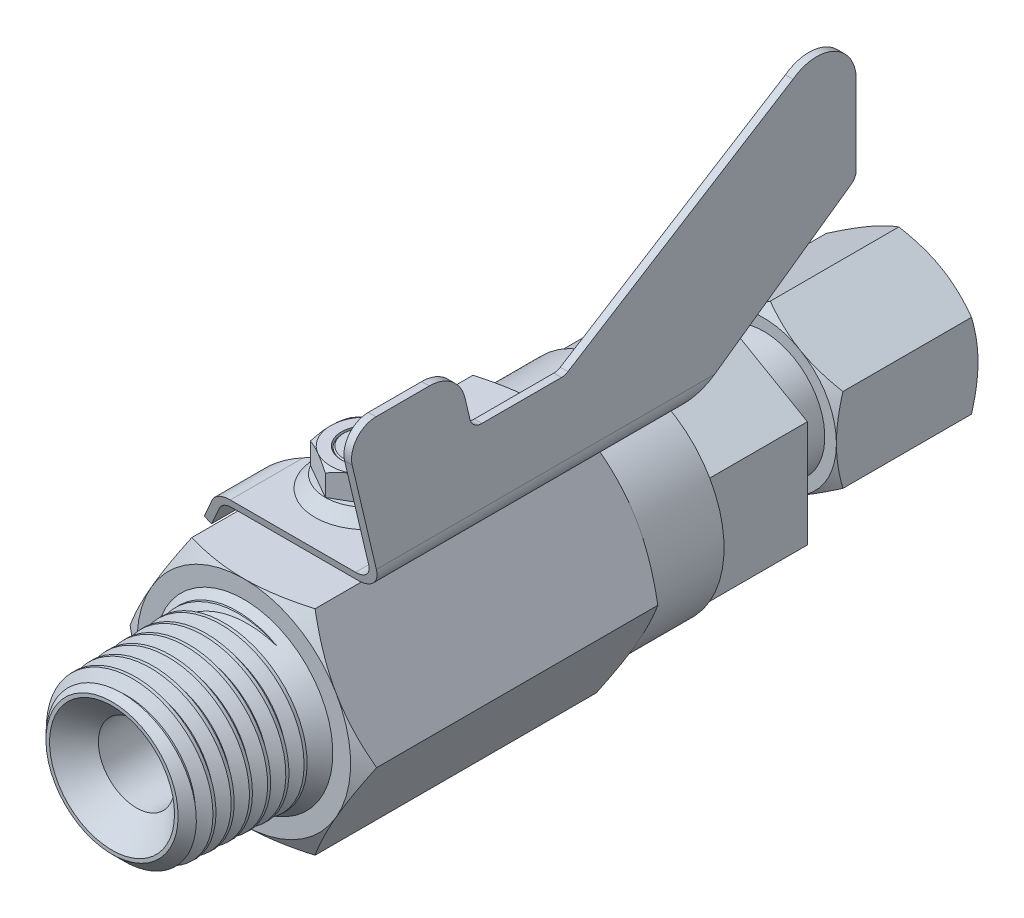
from build123d import *

# Parameters (mm, degrees)
SKETCH1_W              = 31.242
SKETCH1_H              = 12.827
SKETCH2_OUTSIDE_W      = 37.23
SKETCH2_OUTSIDE_H      = 37.23
CUT_EXTRUDE1_DEPTH     = 37.126533
SKETCH5_R              = 4.7498
BOSS_EXTRUDE1_DEPTH    = 1.016
BOSS_EXTRUDE2_DEPTH    = 52.5272
CUT_EXTRUDE2_START     = -19.204414
CUT_EXTRUDE2_DEPTH     = 19.204414
CUT_EXTRUDE3_DEPTH     = 61.997318
SKETCH11_R             = 5.28955
BOSS_EXTRUDE3_DEPTH    = 1.27
BOSS_EXTRUDE3_TAPER    = 40
BOSS_EXTRUDE4_DEPTH    = 2.54
CUT_EXTRUDE4_START     = -7.888877
SKETCH13_R             = 2.54
CUT_EXTRUDE4_DEPTH     = 29.133619
SKETCH14_R             = 2.413
BOSS_EXTRUDE5_DEPTH    = 3.81
CHAMFER1_SIZE          = 0.127
SKETCH15_OUTSIDE_W     = 51.938
SKETCH15_OUTSIDE_H     = 80.399
SKETCH15_OUTSIDE_R     = 3.657999
CUT_EXTRUDE7_DEPTH     = 2.54
CUT_EXTRUDE7_DRAFT     = -60
FILLET1_R              = 2.54
SKETCH16_OUTSIDE_W     = 51.938
SKETCH16_OUTSIDE_H     = 75.366
SKETCH16_OUTSIDE_R     = 11.108508
CUT_EXTRUDE8_DEPTH     = 2.54
CUT_EXTRUDE8_DRAFT     = -60
SKETCH17_OUTSIDE_W     = 51.938
SKETCH17_OUTSIDE_H     = 75.366
SKETCH17_OUTSIDE_R     = 11.108508
CUT_EXTRUDE9_DEPTH     = 2.54
CUT_EXTRUDE9_DRAFT     = -60
CHAMFER2_SIZE          = 1.27
CHAMFER2_SIZE2         = 1.311366
CUT_SWEEP1_PITCH       = 1.840888
CUT_SWEEP1_HEIGHT      = 15.556
CUT_SWEEP1_RADIUS      = 8.14625
CUT_SWEEP1_START_ANGLE = 90
BOSS_EXTRUDE10_DEPTH   = 7.62
BOSS_EXTRUDE11_DEPTH   = 10.16
SKETCH34_R             = 6.35
BOSS_EXTRUDE14_DEPTH   = 5.08
BOSS_EXTRUDE15_DEPTH   = 14.732
SKETCH38_OUTSIDE_W     = 65.132
SKETCH38_OUTSIDE_H     = 88.56
SKETCH38_OUTSIDE_R     = 7.559756
CUT_EXTRUDE10_DEPTH    = 5.08
CUT_EXTRUDE10_DRAFT    = -60
SKETCH39_OUTSIDE_W     = 65.132
SKETCH39_OUTSIDE_H     = 88.56
SKETCH39_OUTSIDE_R     = 7.559756
CUT_EXTRUDE11_DEPTH    = 5.08
CUT_EXTRUDE11_DRAFT    = -60
SKETCH40_R             = 3.9624
CUT_EXTRUDE12_DEPTH    = 82.55
SKETCH41_R             = 4.7625
CUT_EXTRUDE13_DEPTH    = 14.732
CHAMFER4_SIZE          = 2.54


with BuildPart() as part:
    # Sketch1 → Revolve1 (revolve)
    with BuildSketch(Plane(origin=(0, 0, 0), x_dir=(0, 0, -1), z_dir=(1, 0, 0))):
        with Locations((15.621, 6.4135)):
            Rectangle(SKETCH1_W, SKETCH1_H)
    revolve(axis=Axis((0, 0, -31.242), (0, 0, 1)))

    # Sketch2 outside → Cut-Extrude1 (cut, through all)
    with BuildSketch(Plane.XY):
        Rectangle(SKETCH2_OUTSIDE_W, SKETCH2_OUTSIDE_H)
        Polygon((-12.827, 0), (-6.4135, -11.108508), (6.4135, -11.108508), (12.827, 0), (6.4135, 11.108508), (-6.4135, 11.108508), align=None, mode=Mode.SUBTRACT)
    extrude(amount=-CUT_EXTRUDE1_DEPTH, mode=Mode.SUBTRACT)

    # Sketch5 → Boss-Extrude1 (add)
    with BuildSketch(Plane(origin=(0, 11.108508, 0), x_dir=(1, 0, 0), z_dir=(0, 1, 0))):
        with Locations(Location((0, 12.7, 0), (0, 0, 180))):
            Circle(SKETCH5_R)
    extrude(amount=BOSS_EXTRUDE1_DEPTH)


with BuildPart() as body_2:
    # Sketch6 → Boss-Extrude2 (new body)
    with BuildSketch(Plane.XY.offset(-1.5875)):
        with BuildLine():
            Line((-5.973559, 12.124508), (7.08025, 12.124508))
            ThreePointArc((7.08025, 12.124508), (8.876301, 12.868457), (9.62025, 14.664508))
            Line((9.62025, 14.664508), (9.62025, 37.973))
            Line((9.62025, 37.973), (8.8265, 37.973))
            Line((8.8265, 37.973), (8.8265, 14.696258))
            ThreePointArc((8.8265, 14.696258), (8.305736, 13.439022), (7.0485, 12.918258))
            Line((7.0485, 12.918258), (-5.99189, 12.918258))
            ThreePointArc((-5.99189, 12.918258), (-7.26189, 12.577962), (-8.191594, 11.648258))
            Line((-8.191594, 11.648258), (-9.584164, 9.236256))
            Line((-9.584164, 9.236256), (-8.896757, 8.839381))
            Line((-8.896757, 8.839381), (-7.513352, 11.235508))
            ThreePointArc((-7.513352, 11.235508), (-6.862559, 11.886301), (-5.973559, 12.124508))
        make_face()
    extrude(amount=-BOSS_EXTRUDE2_DEPTH)

    # Sketch8 → Cut-Extrude2 (cut)
    with BuildSketch(Plane(origin=(9.62025, 0, 0), x_dir=(0, 0, -1), z_dir=(1, 0, 0)).offset(CUT_EXTRUDE2_START)):
        with BuildLine():
            Line((1.655336, 25.324902), (5.543697, 8.839381))
            Line((5.543697, 8.839381), (1.5875, 8.839381))
            Line((1.5875, 8.839381), (-4.7625, 8.839381))
            Line((-4.7625, 8.839381), (-4.7625, 44.323))
            Line((-4.7625, 44.323), (60.4647, 44.323))
            Line((60.4647, 44.323), (60.4647, 8.839381))
            Line((60.4647, 8.839381), (35.78225, 8.839381))
            Line((35.78225, 8.839381), (35.78225, 12.124508))
            Line((35.78225, 12.124508), (53.576471, 24.669307))
            ThreePointArc((53.576471, 24.669307), (53.972142, 25.122675), (54.1147, 25.707291))
            Line((54.1147, 25.707291), (54.1147, 33.839636))
            ThreePointArc((54.1147, 33.839636), (51.844334, 37.529343), (47.52736, 37.1657))
            Line((47.52736, 37.1657), (24.102603, 22.528287))
            ThreePointArc((24.102603, 22.528287), (23.779665, 22.384506), (23.429605, 22.335308))
            Line((23.429605, 22.335308), (15.147071, 22.335308))
            ThreePointArc((15.147071, 22.335308), (14.358835, 22.609525), (13.910989, 23.313759))
            Line((13.910989, 23.313759), (13.392348, 25.512647))
            ThreePointArc((13.392348, 25.512647), (12.04881, 27.625349), (9.684101, 28.448))
            Line((9.684101, 28.448), (4.1275, 28.448))
            ThreePointArc((4.1275, 28.448), (2.135934, 27.484473), (1.655336, 25.324902))
        make_face()
    extrude(amount=CUT_EXTRUDE2_DEPTH, mode=Mode.SUBTRACT)

    # Sketch10 → Cut-Extrude3 (cut, through all)
    with BuildSketch(Plane(origin=(0, 12.918258, 0), x_dir=(1, 0, 0), z_dir=(0, 1, 0))):
        with BuildLine():
            Line((-9.584164, 7.990088), (-5.781127, 12.423071))
            ThreePointArc((-5.781127, 12.423071), (-5.607243, 12.708663), (-5.533432, 13.034777))
            ThreePointArc((-5.533432, 13.034777), (-4.106476, 16.42395), (-0.872525, 18.174454))
            ThreePointArc((-0.872525, 18.174454), (-0.247775, 18.52493), (0, 19.197056))
            Line((0, 19.197056), (0, 36.908148))
            Line((0, 36.908148), (-9.584164, 36.908148))
            Line((-9.584164, 36.908148), (-9.584164, 7.990088))
        make_face()
    extrude(amount=-CUT_EXTRUDE3_DEPTH, mode=Mode.SUBTRACT)

    # Fillet1
    # the kernel refuses this fillet: 2.54 mm, written as the material it takes off along each edge
    with BuildSketch(Plane(origin=(0, 8.465651, -30.59233), x_dir=(1, 0, 0), z_dir=(0, 0.5761978666695496, -0.817310233904764))) as fillet1_piece_1:
        with BuildLine():
            CenterArc((FILLET1_R, -FILLET1_R), FILLET1_R, 90, 90)
            Line((0, -FILLET1_R), (0, 0))
            Line((0, 0), (FILLET1_R, 0))
        make_face()
    extrude(amount=14.077565, mode=Mode.SUBTRACT)



with BuildPart() as body_3:
    # Sketch11 → Boss-Extrude3 (new body)
    with BuildSketch(Plane(origin=(0, 12.918258, 0), x_dir=(1, 0, 0), z_dir=(0, 1, 0))):
        with Locations((0, 12.7)):
            Circle(SKETCH11_R)
    extrude(amount=BOSS_EXTRUDE3_DEPTH, taper=BOSS_EXTRUDE3_TAPER)


with BuildPart() as body_4:
    # Sketch12 → Boss-Extrude4 (new body)
    with BuildSketch(Plane(origin=(0, 14.188258, 0), x_dir=(1, 0, 0), z_dir=(0, 1, 0))):
        Polygon((0, 16.923893), (-3.657999, 14.811947), (-3.657999, 10.588053), (0, 8.476107), (3.657999, 10.588053), (3.657999, 14.811947), align=None)
    extrude(amount=BOSS_EXTRUDE4_DEPTH)


with BuildPart() as cut_extrude4_tool:
    # Sketch13 → Cut-Extrude4 (new body)
    with BuildSketch(Plane(origin=(0, 16.728258, 0), x_dir=(1, 0, 0), z_dir=(0, 1, 0)).offset(CUT_EXTRUDE4_START)):
        with Locations(Location((0, 12.7, 0), (0, 0, 270))):
            Circle(SKETCH13_R)
    extrude(amount=CUT_EXTRUDE4_DEPTH)


with BuildPart() as body_3_1:
    add(body_3.part)

    # Cut-Extrude4: cut by cut_extrude4_tool
    add(cut_extrude4_tool.part, mode=Mode.SUBTRACT)


with BuildPart() as body_4_1:
    add(body_4.part)

    # Cut-Extrude4: cut by cut_extrude4_tool
    add(cut_extrude4_tool.part, mode=Mode.SUBTRACT)


with BuildPart() as body_5:
    # Sketch14 → Boss-Extrude5 (new body)
    with BuildSketch(Plane(origin=(0, 12.918258, 0), x_dir=(1, 0, 0), z_dir=(0, 1, 0))):
        with Locations(Location((0, 12.7, 0), (0, 0, 270))):
            Circle(SKETCH14_R)
    extrude(amount=BOSS_EXTRUDE5_DEPTH)

    # Chamfer1
    chamfer1_edges = [body_5.edges().sort_by_distance(p)[0] for p in [
        (0, 16.728258, -15.113),
    ]]
    chamfer(chamfer1_edges, length=CHAMFER1_SIZE)


with BuildPart() as cut_extrude7_tool:
    # Sketch15 outside → Cut-Extrude7 (with draft: the straight prism first)
    with BuildSketch(Plane(origin=(0, 16.728258, 0), x_dir=(1, 0, 0), z_dir=(0, 1, 0))):
        with Locations((0, 27.0575)):
            Rectangle(SKETCH15_OUTSIDE_W, SKETCH15_OUTSIDE_H)
        with Locations((0, 12.7)):
            Circle(SKETCH15_OUTSIDE_R, mode=Mode.SUBTRACT)
    extrude(amount=-CUT_EXTRUDE7_DEPTH)
    # Cut-Extrude7: the draft: its side faces are tilted about the plane it starts from
    cut_extrude7_sides = [cut_extrude7_tool.faces().sort_by_distance(p)[0] for p in [
        (0, 15.458258, 13.142),
        (25.969, 15.458258, -27.0575),
        (0, 15.458258, -67.257),
        (-25.969, 15.458258, -27.0575),
        (-3.657999, 15.458258, -12.7),
    ]]
    draft(cut_extrude7_sides, Plane(origin=(0, 16.728258, 0), x_dir=(1, 0, 0), z_dir=(0, 1, 0)), CUT_EXTRUDE7_DRAFT)


with BuildPart() as body_4_2:
    add(body_4_1.part)

    # Cut-Extrude7: cut by cut_extrude7_tool
    add(cut_extrude7_tool.part, mode=Mode.SUBTRACT)


with BuildPart() as cut_extrude8_tool:
    # Sketch16 outside → Cut-Extrude8 (with draft: the straight prism first)
    with BuildSketch(Plane.XY):
        with Locations((0, 13.432)):
            Rectangle(SKETCH16_OUTSIDE_W, SKETCH16_OUTSIDE_H)
        Circle(SKETCH16_OUTSIDE_R, mode=Mode.SUBTRACT)
    extrude(amount=-CUT_EXTRUDE8_DEPTH)
    # Cut-Extrude8: the draft: its side faces are tilted about the plane it starts from
    cut_extrude8_sides = [cut_extrude8_tool.faces().sort_by_distance(p)[0] for p in [
        (0, -24.251, -1.27),
        (25.969, 13.432, -1.27),
        (0, 51.115, -1.27),
        (-25.969, 13.432, -1.27),
        (-11.108508, 0, -1.27),
    ]]
    draft(cut_extrude8_sides, Plane.XY, CUT_EXTRUDE8_DRAFT)


with BuildPart() as part_1:
    add(part.part)

    # Cut-Extrude8: cut by cut_extrude8_tool
    add(cut_extrude8_tool.part, mode=Mode.SUBTRACT)


with BuildPart() as cut_extrude9_tool:
    # Sketch17 outside → Cut-Extrude9 (with draft: the straight prism first)
    with BuildSketch(Plane(origin=(0, 0, -31.242), x_dir=(-1, 0, 0), z_dir=(0, 0, -1))):
        with Locations((0, 13.432)):
            Rectangle(SKETCH17_OUTSIDE_W, SKETCH17_OUTSIDE_H)
        Circle(SKETCH17_OUTSIDE_R, mode=Mode.SUBTRACT)
    extrude(amount=-CUT_EXTRUDE9_DEPTH)
    # Cut-Extrude9: the draft: its side faces are tilted about the plane it starts from
    cut_extrude9_sides = [cut_extrude9_tool.faces().sort_by_distance(p)[0] for p in [
        (0, -24.251, -29.972),
        (-25.969, 13.432, -29.972),
        (0, 51.115, -29.972),
        (25.969, 13.432, -29.972),
        (11.108508, 0, -29.972),
    ]]
    draft(cut_extrude9_sides, Plane(origin=(0, 0, -31.242), x_dir=(-1, 0, 0), z_dir=(0, 0, -1)), CUT_EXTRUDE9_DRAFT)


with BuildPart() as part_2:
    add(part_1.part)

    # Cut-Extrude9: cut by cut_extrude9_tool
    add(cut_extrude9_tool.part, mode=Mode.SUBTRACT)



with BuildPart() as body_6:
    # Sketch19 → Revolve2 (revolve)
    with BuildSketch(Plane(origin=(0, 0, 0), x_dir=(0, 0, -1), z_dir=(1, 0, 0)), mode=Mode.PRIVATE) as revolve2_sk:
        Polygon((0, 0), (-13.716, 0), (-13.716, 8.14625), (0, 8.5725), align=None)
    revolve(revolve2_sk.sketch.rotate(Axis((0, 0, 0), (0, 0, 1)), 90), axis=Axis((0, 0, 0), (0, 0, 1)))

    # Chamfer2
    chamfer2_edges = [body_6.edges().sort_by_distance(p)[0] for p in [
        (8.14625, 0, 13.716),
    ]]
    chamfer2_side = [body_6.faces().sort_by_distance(p)[0] for p in [
        (0, 0, 13.716),
    ]]
    chamfer(chamfer2_edges, length=CHAMFER2_SIZE, length2=CHAMFER2_SIZE2, reference=chamfer2_side[0])

    # Cut-Sweep1: sweep along a helix
    with BuildLine() as cut_sweep1_path:
        # a taper helix: rise per turn along the axis 1.84, along the cone's slant (build123d's pitch) 1.840888
        add(Helix(CUT_SWEEP1_PITCH, CUT_SWEEP1_HEIGHT, CUT_SWEEP1_RADIUS, center=(0, 0, 13.716), direction=(0, 0, -1), cone_angle=1.78, mode=Mode.PRIVATE).rotate(Axis((0, 0, 13.716), (0, 0, -1)), CUT_SWEEP1_START_ANGLE))
    # Sketch22 → Cut-Sweep1 (sweep, cut)
    with BuildSketch(Plane(origin=(0, 0, 0), x_dir=(0, 0, -1), z_dir=(1, 0, 0))):
        Polygon((-15.326, 8.186983), (-14.636, 6.991868), (-14.406, 6.991868), (-13.716, 8.186983), (-13.63035, 8.335333), align=None)
    sweep(path=cut_sweep1_path.line, is_frenet=True, mode=Mode.SUBTRACT)


with BuildPart() as part_3:
    add(part_2.part)

    add(body_6.part)  # Boss-Extrude6 merges body 6
    # Boss-Extrude6 cone 1 section (through the dimple's axis) → Boss-Extrude6 (revolve)
    with BuildSketch(Plane.YZ):
        Polygon((0, 0), (9.2583, 0), (0, 9.2583), align=None)
    revolve(axis=Axis((0, 0, 0), (0, 0, 1)))


with BuildPart() as body_2_1:
    add(body_2.part)

    add(part_3.part)  # Boss-Extrude10 merges part
    # Sketch32 → Boss-Extrude10 (add)
    with BuildSketch(Plane(origin=(0, 0, -31.242), x_dir=(-1, 0, 0), z_dir=(0, 0, -1))):
        with BuildLine():
            ThreePointArc((9.62025, 5.554254), (5.554254, 9.62025), (0, 11.108508))
            ThreePointArc((0, 11.108508), (-5.554254, 9.62025), (-9.62025, 5.554254))
            ThreePointArc((-9.62025, 5.554254), (-11.108508, 0), (-9.62025, -5.554254))
            ThreePointArc((-9.62025, -5.554254), (-5.554254, -9.62025), (0, -11.108508))
            ThreePointArc((0, -11.108508), (5.554254, -9.62025), (9.62025, -5.554254))
            ThreePointArc((9.62025, -5.554254), (11.108508, 0), (9.62025, 5.554254))
        make_face()
    extrude(amount=BOSS_EXTRUDE10_DEPTH)

    # Sketch33 → Boss-Extrude11 (add)
    with BuildSketch(Plane(origin=(0, 0, -38.862), x_dir=(-1, 0, 0), z_dir=(0, 0, -1))):
        Polygon((0, 11.108508), (-9.62025, 5.554254), (-9.62025, -5.554254), (0, -11.108508), (9.62025, -5.554254), (9.62025, 5.554254), align=None)
    extrude(amount=BOSS_EXTRUDE11_DEPTH)

    # Sketch34 → Boss-Extrude14 (add)
    with BuildSketch(Plane(origin=(0, 0, -49.022), x_dir=(-1, 0, 0), z_dir=(0, 0, -1))):
        Circle(SKETCH34_R)
    extrude(amount=BOSS_EXTRUDE14_DEPTH)

    # Sketch37 → Boss-Extrude15 (add)
    with BuildSketch(Plane(origin=(0, 0, -54.102), x_dir=(-1, 0, 0), z_dir=(0, 0, -1))):
        Polygon((0, 8.729254), (-7.559756, 4.364627), (-7.559756, -4.364627), (0, -8.729254), (7.559756, -4.364627), (7.559756, 4.364627), align=None)
    extrude(amount=BOSS_EXTRUDE15_DEPTH)


with BuildPart() as cut_extrude10_tool:
    # Sketch38 outside → Cut-Extrude10 (with draft: the straight prism first)
    with BuildSketch(Plane.XY.offset(-54.102)):
        with Locations((0, 13.432)):
            Rectangle(SKETCH38_OUTSIDE_W, SKETCH38_OUTSIDE_H)
        Circle(SKETCH38_OUTSIDE_R, mode=Mode.SUBTRACT)
    extrude(amount=-CUT_EXTRUDE10_DEPTH)
    # Cut-Extrude10: the draft: its side faces are tilted about the plane it starts from
    cut_extrude10_sides = [cut_extrude10_tool.faces().sort_by_distance(p)[0] for p in [
        (0, -30.848, -56.642),
        (32.566, 13.432, -56.642),
        (0, 57.712, -56.642),
        (-32.566, 13.432, -56.642),
        (-7.559756, 0, -56.642),
    ]]
    draft(cut_extrude10_sides, Plane.XY.offset(-54.102), CUT_EXTRUDE10_DRAFT)


with BuildPart() as body_2_2:
    add(body_2_1.part)

    # Cut-Extrude10: cut by cut_extrude10_tool
    add(cut_extrude10_tool.part, mode=Mode.SUBTRACT)


with BuildPart() as cut_extrude11_tool:
    # Sketch39 outside → Cut-Extrude11 (with draft: the straight prism first)
    with BuildSketch(Plane(origin=(0, 0, -68.834), x_dir=(-1, 0, 0), z_dir=(0, 0, -1))):
        with Locations((0, 13.432)):
            Rectangle(SKETCH39_OUTSIDE_W, SKETCH39_OUTSIDE_H)
        Circle(SKETCH39_OUTSIDE_R, mode=Mode.SUBTRACT)
    extrude(amount=-CUT_EXTRUDE11_DEPTH)
    # Cut-Extrude11: the draft: its side faces are tilted about the plane it starts from
    cut_extrude11_sides = [cut_extrude11_tool.faces().sort_by_distance(p)[0] for p in [
        (0, -30.848, -66.294),
        (-32.566, 13.432, -66.294),
        (0, 57.712, -66.294),
        (32.566, 13.432, -66.294),
        (7.559756, 0, -66.294),
    ]]
    draft(cut_extrude11_sides, Plane(origin=(0, 0, -68.834), x_dir=(-1, 0, 0), z_dir=(0, 0, -1)), CUT_EXTRUDE11_DRAFT)


with BuildPart() as body_2_3:
    add(body_2_2.part)

    # Cut-Extrude11: cut by cut_extrude11_tool
    add(cut_extrude11_tool.part, mode=Mode.SUBTRACT)

    # Sketch40 → Cut-Extrude12 (cut)
    with BuildSketch(Plane.XY.offset(13.716)):
        Circle(SKETCH40_R)
    extrude(amount=-CUT_EXTRUDE12_DEPTH, mode=Mode.SUBTRACT)

    # Sketch41 → Cut-Extrude13 (cut)
    with BuildSketch(Plane(origin=(0, 0, -68.834), x_dir=(-1, 0, 0), z_dir=(0, 0, -1))):
        Circle(SKETCH41_R)
    extrude(amount=-CUT_EXTRUDE13_DEPTH, mode=Mode.SUBTRACT)

    # Chamfer4
    chamfer4_edges = [body_2_3.edges().sort_by_distance(p)[0] for p in [
        (-3.9624, 0, 13.716),
    ]]
    chamfer(chamfer4_edges, length=CHAMFER4_SIZE)


solid = Compound([body_3_1.part, body_5.part, body_4_2.part, body_2_3.part])
